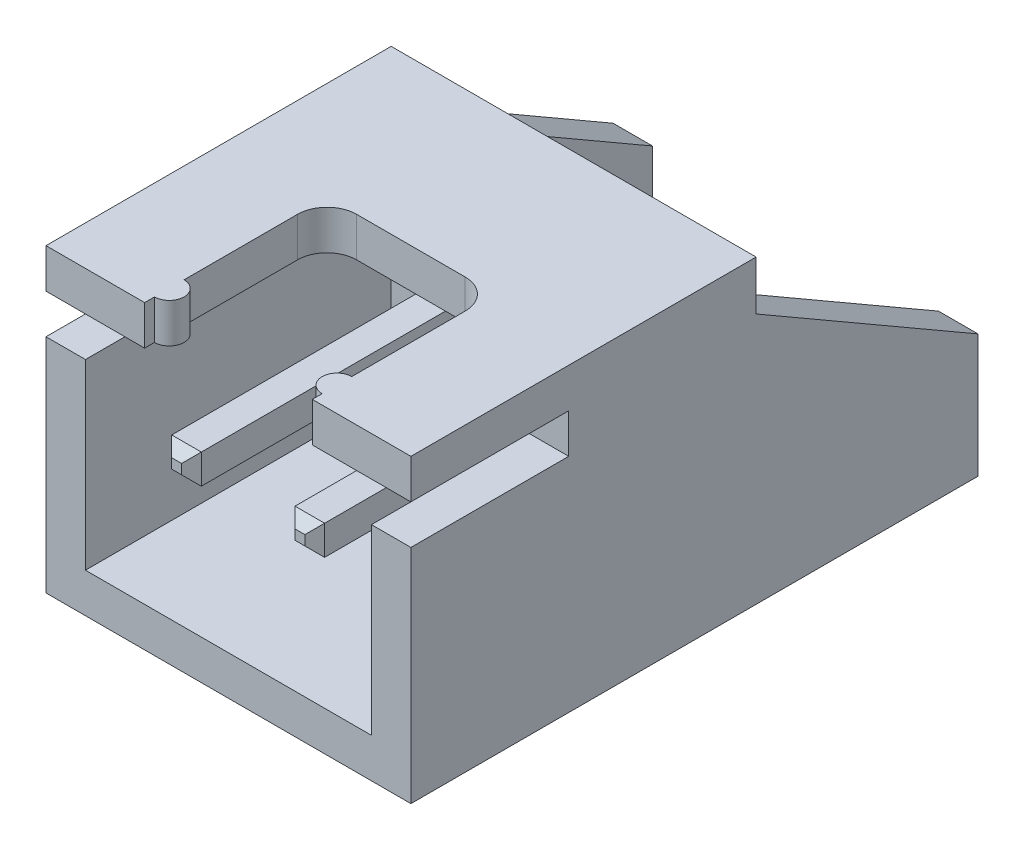
from build123d import *

# Parameters (mm, degrees)
EXTRUSION1_DEPTH                        = 6.1
COQUE1_T                                = -0.8
ENL_V_MAT_EXTRU_1_DEPTH                 = 15.973977428
ENL_V_MAT_EXTRU_3_REACH                 = 16.666
ESQUISSE3_4_W                           = 0.8
ESQUISSE3_4_H                           = 3.2
ENL_V_MAT_EXTRU_4_DEPTH                 = 0.8
PICO01_DEPTH                            = 0.3
CHANFREIN1_SIZE                         = 0.2
CONG_1_R                                = 0.6
CONG_2_R                                = 1.2
ESQUISSE5_R                             = 0.3
EXTRUSION2_DEPTH                        = 2
R_P_TITION_LIN_AIRE1_COUNT              = 2
R_P_TITION_LIN_AIRE1_PITCH              = 2.5
CHANFREIN1_OF_R_P_TITION_LIN_AIRE1_SIZE = 0.2
CONG_1_OF_R_P_TITION_LIN_AIRE1_R        = 0.6
CONG_2_OF_R_P_TITION_LIN_AIRE1_R        = 1.2
ENL_V_MAT_EXTRU_5_REACH                 = 17.894
ESQUISSE6_W                             = 0.5
ESQUISSE6_H                             = 3.7


with BuildPart() as part:
    # Esquisse1 → Extrusion1 (new body)
    with BuildSketch(Plane(origin=(0, 0, 0), x_dir=(1, 0, 0), z_dir=(0, 1, 0))):
        Polygon((0.8, 11.5), (0.8, 7), (6.6, 7), (6.6, 11.5), (7.4, 11.5), (7.4, 0), (0, 0), (0, 11.5), align=None)
    extrude(amount=EXTRUSION1_DEPTH)

    # Coque1
    coque1_openings = [part.faces().sort_by_distance(p)[0] for p in [
        (3.7, 3.05, 0),
    ]]
    offset(amount=COQUE1_T, openings=coque1_openings, kind=Kind.INTERSECTION)

    # Esquisse2 → Enlèv. mat.-Extru.1 (cut, through all)
    with BuildSketch(Plane(origin=(7.4, 0, 0), x_dir=(0, 0, -1), z_dir=(1, 0, 0))):
        Polygon((11.5, 6.1), (11.5, 2.5), (7, 5.1), (7, 6.1), align=None)
    extrude(amount=-ENL_V_MAT_EXTRU_1_DEPTH, mode=Mode.SUBTRACT)

    # Esquisse3 → Enlèv. mat.-Extru.3 (cut, up to next)
    with BuildSketch(Plane(origin=(0, 5.3, 0), x_dir=(-1, 0, 0), z_dir=(0, 1, 0)), mode=Mode.PRIVATE) as enl_v_mat_extru_3_sk1:
        with BuildLine():
            Line((-3.95, 0), (-5.4, 0))
            Line((-5.4, 0), (-5.4, -0.2))
            ThreePointArc((-5.4, -0.2), (-5.1, -0.5), (-5.4, -0.8))
            Line((-5.4, -0.8), (-5.4, -3.1))
            ThreePointArc((-5.4, -3.1), (-5.224264069, -3.524264069), (-4.8, -3.7))
            Line((-4.8, -3.7), (-3.95, -3.7))
            Line((-3.95, -3.7), (-3.95, 0))
        make_face()
    enl_v_mat_extru_3_tool1 = extrude(enl_v_mat_extru_3_sk1.sketch, amount=ENL_V_MAT_EXTRU_3_REACH, mode=Mode.PRIVATE) & part.part
    # Esquisse3 → Enlèv. mat.-Extru.3 (cut, up to next)
    with BuildSketch(Plane(origin=(0, 5.3, 0), x_dir=(-1, 0, 0), z_dir=(0, 1, 0)), mode=Mode.PRIVATE) as enl_v_mat_extru_3_sk2:
        with BuildLine():
            Line((-2, -0.2), (-2, 0))
            Line((-2, 0), (-3.45, 0))
            Line((-3.45, 0), (-3.45, -3.7))
            Line((-3.45, -3.7), (-2.6, -3.7))
            ThreePointArc((-2.6, -3.7), (-2.175735931, -3.524264069), (-2, -3.1))
            Line((-2, -3.1), (-2, -0.8))
            ThreePointArc((-2, -0.8), (-2.3, -0.5), (-2, -0.2))
        make_face()
    enl_v_mat_extru_3_tool2 = extrude(enl_v_mat_extru_3_sk2.sketch, amount=ENL_V_MAT_EXTRU_3_REACH, mode=Mode.PRIVATE) & part.part
    add(enl_v_mat_extru_3_tool1.solids().sort_by_distance((4.64971, 5.3, -1.861325))[0], mode=Mode.SUBTRACT)
    add(enl_v_mat_extru_3_tool2.solids().sort_by_distance((2.75029, 5.3, -1.861325))[0], mode=Mode.SUBTRACT)

    # Esquisse3<4> → Enlèv. mat.-Extru.4 (cut)
    with BuildSketch(Plane(origin=(0, 5.3, 0), x_dir=(-1, 0, 0), z_dir=(0, 1, 0))):
        with Locations((-7, -1.6)):
            Rectangle(ESQUISSE3_4_W, ESQUISSE3_4_H)
        with Locations((-0.4, -1.6)):
            Rectangle(ESQUISSE3_4_W, ESQUISSE3_4_H)
    extrude(amount=-ENL_V_MAT_EXTRU_4_DEPTH, mode=Mode.SUBTRACT)

    # Esquisse4 → pico01 (add, symmetric)
    with BuildSketch(Plane(origin=(2.45, 0, 0), x_dir=(0, 0, -1), z_dir=(1, 0, 0))):
        Polygon((9.5, 0), (9.5, 3.65), (0.2, 3.65), (0.2, 3.05), (8.9, 3.05), (8.9, 0), align=None)
    pico01 = extrude(amount=PICO01_DEPTH, both=True)

    # Chanfrein1
    chanfrein1_edges = [part.edges().sort_by_distance(p)[0] for p in [
        (2.15, 3.35, -0.2),
        (2.45, 3.05, -0.2),
        (2.75, 3.35, -0.2),
        (2.45, 3.65, -0.2),
    ]]
    chamfer(chanfrein1_edges, length=CHANFREIN1_SIZE)

    # Congé1
    cong_1_edges = [part.edges().sort_by_distance(p)[0] for p in [
        (2.45, 3.05, -8.9),
    ]]
    fillet(cong_1_edges, radius=CONG_1_R)

    # Congé2
    cong_2_edges = [part.edges().sort_by_distance(p)[0] for p in [
        (2.45, 3.65, -9.5),
    ]]
    fillet(cong_2_edges, radius=CONG_2_R)

    # Esquisse5 → Extrusion2 (add)
    with BuildSketch(Plane.XZ):
        with Locations((2.45, -9.2)):
            Circle(ESQUISSE5_R)
    extrusion2 = extrude(amount=EXTRUSION2_DEPTH)

    # Répétition linéaire1: pico01, Extrusion2 ×2
    with Locations(*[(i * R_P_TITION_LIN_AIRE1_PITCH, 0, 0) for i in range(1, R_P_TITION_LIN_AIRE1_COUNT)]):
        add(pico01)
        add(extrusion2)

    # Chanfrein1 of Répétition linéaire1
    chanfrein1_of_r_p_tition_lin_aire1_edges = [part.edges().sort_by_distance(p)[0] for p in [
        (4.65, 3.35, -0.2),
        (4.95, 3.05, -0.2),
        (5.25, 3.35, -0.2),
        (4.95, 3.65, -0.2),
    ]]
    chamfer(chanfrein1_of_r_p_tition_lin_aire1_edges, length=CHANFREIN1_OF_R_P_TITION_LIN_AIRE1_SIZE)

    # Congé1 of Répétition linéaire1
    cong_1_of_r_p_tition_lin_aire1_edges = [part.edges().sort_by_distance(p)[0] for p in [
        (4.95, 3.05, -8.9),
    ]]
    fillet(cong_1_of_r_p_tition_lin_aire1_edges, radius=CONG_1_OF_R_P_TITION_LIN_AIRE1_R)

    # Congé2 of Répétition linéaire1
    cong_2_of_r_p_tition_lin_aire1_edges = [part.edges().sort_by_distance(p)[0] for p in [
        (4.95, 3.65, -9.5),
    ]]
    fillet(cong_2_of_r_p_tition_lin_aire1_edges, radius=CONG_2_OF_R_P_TITION_LIN_AIRE1_R)

    # Esquisse6 → Enlèv. mat.-Extru.5 (cut, up to next)
    with BuildSketch(Plane(origin=(0, 6.1, 0), x_dir=(-1, 0, 0), z_dir=(0, 1, 0)), mode=Mode.PRIVATE) as enl_v_mat_extru_5_sk1:
        with Locations((-3.7, -1.85)):
            Rectangle(ESQUISSE6_W, ESQUISSE6_H)
    enl_v_mat_extru_5_tool1 = extrude(enl_v_mat_extru_5_sk1.sketch, amount=-ENL_V_MAT_EXTRU_5_REACH, mode=Mode.PRIVATE) & part.part
    add(enl_v_mat_extru_5_tool1.solids().sort_by_distance((3.7, 6.1, -1.85))[0], mode=Mode.SUBTRACT)


solid = part.part
